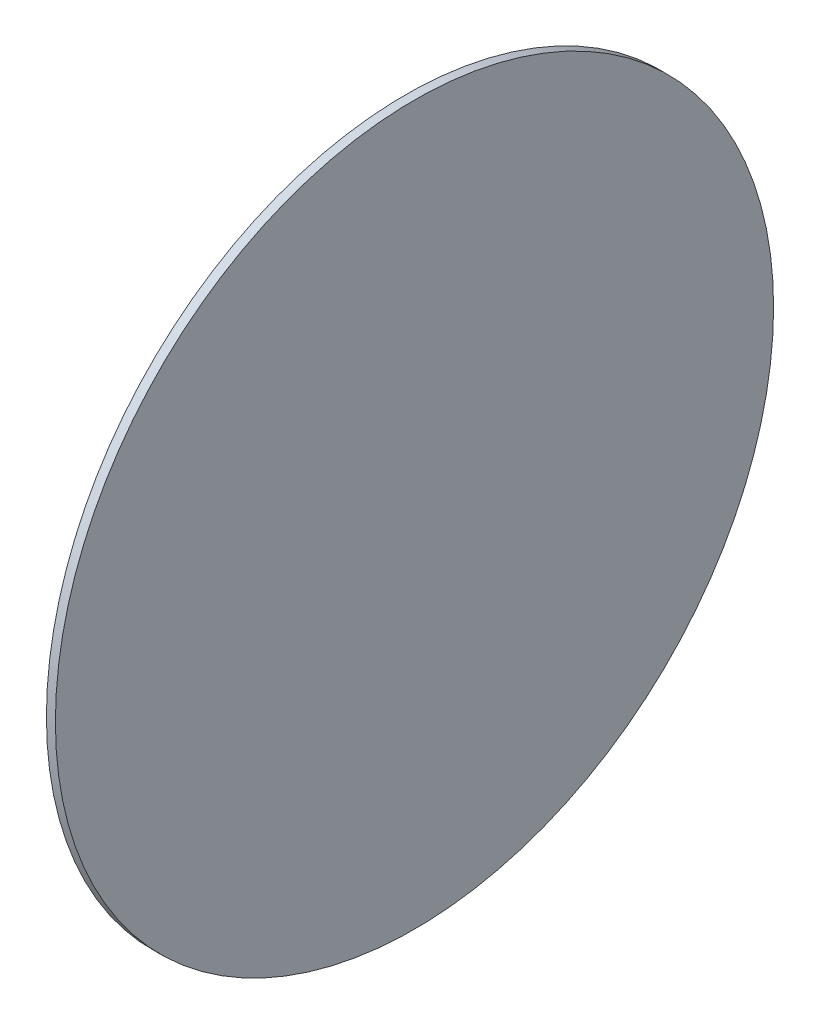
from build123d import *

# Parameters (mm, degrees)
SKETCH1_R             = 40
BOSS_EXTRUDE1_DEPTH   = 1
SCALE1_SCALE          = 0.5
SCALE3_SCALE          = 0.625
BODY_MOVE_COPY4_ANGLE = 30
BODY_MOVE_COPY5_ANGLE = 30


with BuildPart() as part:
    # Sketch1 → Boss-Extrude1 (new body)
    with BuildSketch(Plane(origin=(0, 0, 0), x_dir=(0, 0, -1), z_dir=(1, 0, 0))):
        Circle(SKETCH1_R)
    extrude(amount=BOSS_EXTRUDE1_DEPTH)


with BuildPart() as part_1:
    # Scale1: scaled about (0.5, 0, 0)
    add(part.part.scale(SCALE1_SCALE).moved(Location((0.25, 0, 0))))


with BuildPart() as part_2:
    # Body-Move/Copy2: moved
    add(part_1.part.moved(Location((4.171055646, 0, 0))))


with BuildPart() as part_3:
    # Scale3: scaled about (4.671055646, 0, 0)
    add(part_2.part.scale(SCALE3_SCALE).moved(Location((1.751645867, 0, 0))))


with BuildPart() as part_4:
    # Body-Move/Copy4: read off the stored shape, not the designer's step
    # Body-Move/Copy4: moved
    add(part_3.part.moved(Location((-0.8605566, 0, -3.1693539))).rotate(Axis((0, 0, 0), (0, -1, 0)), BODY_MOVE_COPY4_ANGLE))


with BuildPart() as part_5:
    # Body-Move/Copy5: read off the stored shape, not the designer's step
    # Body-Move/Copy5: moved
    add(part_4.part.moved(Location((-0.3011634, 0, 2.7353489))).rotate(Axis((0, 0, 0), (0, 1, 0)), BODY_MOVE_COPY5_ANGLE))


solid = part_5.part
